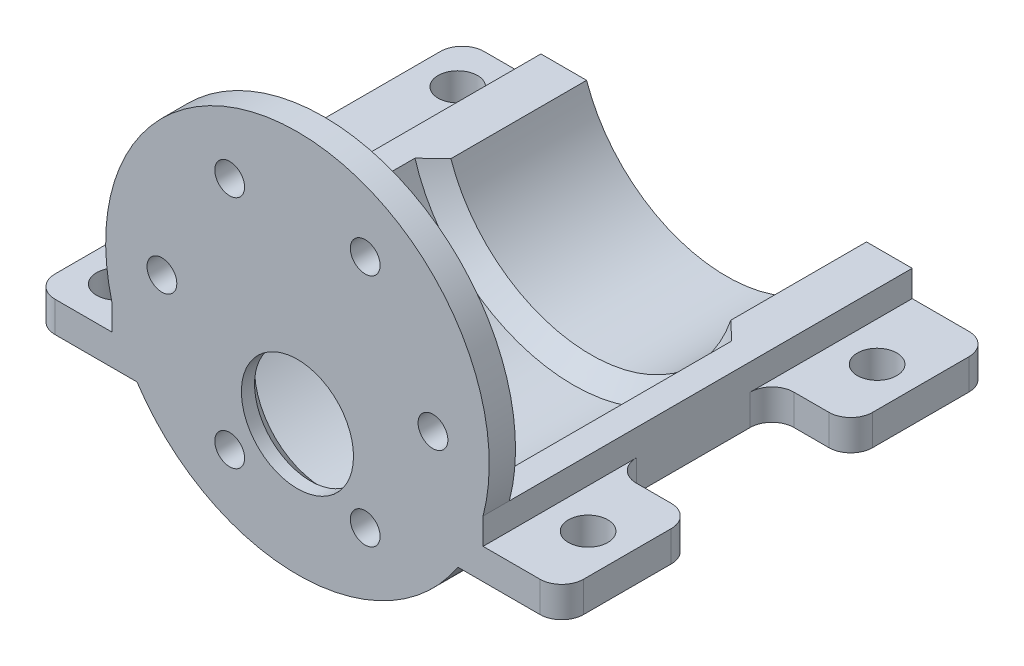
from build123d import *
from build123d.topology import SkipClean

# Parameters (mm, degrees)
BOSS_EXTRUDE1_START     = 94
SKETCH1_R               = 21.9
SKETCH1_R_2             = 1.7
SKETCH1_R_3             = 6.4
BOSS_EXTRUDE1_DEPTH     = 3
BOSS_EXTRUDE2_START     = 91
BOSS_EXTRUDE2_DEPTH     = 27.5
BOSS_EXTRUDE3_START     = 45
BOSS_EXTRUDE3_DEPTH     = 18.5
BOSS_EXTRUDE7_START     = 94
BOSS_EXTRUDE7_DEPTH     = 49
CUT_EXTRUDE5_DEPTH      = 104.301419283
CUT_EXTRUDE5_DEPTH_BACK = 104.301419283
SKETCH4_W               = 8.985048174
SKETCH4_H               = 18
SKETCH4_R               = 2.25
CHAMFER3_SIZE           = 3
CHAMFER4_SIZE           = 1.5
FILLET2_R               = 2.5


with BuildPart() as part:
    # Sketch1 → Boss-Extrude1 (new body)
    with BuildSketch(Plane.XY.offset(BOSS_EXTRUDE1_START)):
        Circle(SKETCH1_R)
        with Locations((15.475, 0)):
            Circle(SKETCH1_R_2, mode=Mode.SUBTRACT)
        with Locations((7.7375, -13.401743124)):
            Circle(SKETCH1_R_2, mode=Mode.SUBTRACT)
        with Locations((-7.7375, -13.401743124)):
            Circle(SKETCH1_R_2, mode=Mode.SUBTRACT)
        with Locations((-15.475, 0)):
            Circle(SKETCH1_R_2, mode=Mode.SUBTRACT)
        with Locations((-7.7375, 13.401743124)):
            Circle(SKETCH1_R_2, mode=Mode.SUBTRACT)
        with Locations((7.7375, 13.401743124)):
            Circle(SKETCH1_R_2, mode=Mode.SUBTRACT)
        with Locations((0, -7)):
            Circle(SKETCH1_R_3, mode=Mode.SUBTRACT)
    extrude(amount=-BOSS_EXTRUDE1_DEPTH)

    # Sketch1<5> → Boss-Extrude2 (add)
    with BuildSketch(Plane.XY.offset(BOSS_EXTRUDE2_START)):
        with BuildLine():
            ThreePointArc((18.319661569, -12), (19.330787418, -10.292262036), (20.183161298, -8.5))
            Line((20.183161298, -8.5), (16.880758277, -8.5))
            ThreePointArc((16.880758277, -8.5), (0, -18.9), (-16.880758277, -8.5))
            Line((-16.880758277, -8.5), (-20.183161298, -8.5))
            ThreePointArc((-20.183161298, -8.5), (-19.330787418, -10.292262036), (-18.319661569, -12))
            ThreePointArc((-18.319661569, -12), (0, -21.9), (18.319661569, -12))
        make_face()
        with BuildLine():
            Line((-20.183161298, -8.5), (-16.880758277, -8.5))
            ThreePointArc((-16.880758277, -8.5), (-17.545632887, -7.025721786), (-18.082035284, -5.5))
            Line((-18.082035284, -5.5), (-21.198113124, -5.5))
            ThreePointArc((-21.198113124, -5.5), (-20.744938375, -7.018371022), (-20.183161298, -8.5))
        make_face()
        with BuildLine():
            Line((16.880758277, -8.5), (20.183161298, -8.5))
            ThreePointArc((20.183161298, -8.5), (20.744938375, -7.018371022), (21.198113124, -5.5))
            Line((21.198113124, -5.5), (18.082035284, -5.5))
            ThreePointArc((18.082035284, -5.5), (17.545632887, -7.025721786), (16.880758277, -8.5))
        make_face()
    extrude(amount=-BOSS_EXTRUDE2_DEPTH)

    # Sketch1<6> → Boss-Extrude3 (add)
    with SkipClean():  # the faces are left unmerged after this step: merging them gives an invalid solid
        with BuildSketch(Plane.XY.offset(BOSS_EXTRUDE3_START)):
            with BuildLine():
                Line((21.198113124, -5.5), (15.979987484, -5.5))
                ThreePointArc((15.979987484, -5.5), (0, -16.9), (-15.979987484, -5.5))
                Line((-15.979987484, -5.5), (-21.198113124, -5.5))
                ThreePointArc((-21.198113124, -5.5), (0, -21.9), (21.198113124, -5.5))
            make_face()
        extrude(amount=BOSS_EXTRUDE3_DEPTH)

    # Sketch1<11> → Boss-Extrude7 (add)
    with SkipClean():  # the faces are left unmerged after this step: merging them gives an invalid solid
        with BuildSketch(Plane.XY.offset(BOSS_EXTRUDE7_START)):
            with BuildLine():
                ThreePointArc((21.198113124, -5.5), (20.024388359, -8.867574124), (18.319661569, -12))
                Line((18.319661569, -12), (30.183161298, -12))
                Line((30.183161298, -12), (30.183161298, -8.5))
                Line((30.183161298, -8.5), (21.198113124, -8.5))
                Line((21.198113124, -8.5), (21.198113124, -5.5))
            make_face()
            with BuildLine():
                Line((-30.183161298, -12), (-18.319661569, -12))
                ThreePointArc((-18.319661569, -12), (-20.024388359, -8.867574124), (-21.198113124, -5.5))
                Line((-21.198113124, -5.5), (-21.198113124, -8.5))
                Line((-21.198113124, -8.5), (-30.183161298, -8.5))
                Line((-30.183161298, -8.5), (-30.183161298, -12))
            make_face()
        extrude(amount=-BOSS_EXTRUDE7_DEPTH)

    # Sketch4 → Cut-Extrude5 (cut, two sides: drawn at the far end of the back side and taken through both)
    with SkipClean():  # the faces are left unmerged after this step: merging them gives an invalid solid
        with BuildSketch(Plane(origin=(0, -8.5, 0), x_dir=(1, 0, 0), z_dir=(0, 1, 0)).offset(-CUT_EXTRUDE5_DEPTH_BACK)):
            with Locations((25.690637211, -70)):
                Rectangle(SKETCH4_W, SKETCH4_H)
            with Locations(Location((-25.690637211, -50, 0), (0, 0, 270))):
                Circle(SKETCH4_R)
            with Locations(Location((-25.690637211, -89, 0), (0, 0, 270))):
                Circle(SKETCH4_R)
            with Locations(Location((25.690637211, -86.5, 0), (0, 0, 270))):
                Circle(SKETCH4_R)
            with Locations(Location((25.690637211, -53.5, 0), (0, 0, 270))):
                Circle(SKETCH4_R)
        extrude(amount=CUT_EXTRUDE5_DEPTH + CUT_EXTRUDE5_DEPTH_BACK, mode=Mode.SUBTRACT)

    # Chamfer3
    # the kernel refuses this chamfer: 3 mm, written as the material it takes off along each edge
    with BuildSketch(Plane(origin=(0, 0, 63.5), x_dir=(0.9921367643584464, 0.1251584627915844, 0), z_dir=(-0.1251584627915844, 0.9921367643584464, 0))) as chamfer3_piece_1_section:
        Polygon((16.9 + CHAMFER3_SIZE, 0), (16.9, CHAMFER3_SIZE), (16.9, 0), align=None)
    chamfer3_piece_1 = revolve(axis=Axis((0, 0, 63.5), (0, 0, -1)), revolution_arc=194.379813793, mode=Mode.PRIVATE)
    chamfer3_piece_1 = chamfer3_piece_1 & Plane(origin=(0, 0, 61.502732277), x_dir=(0.8931618135876879, -0.4497354497354555, 0), z_dir=(0, 0, 1)) * Cylinder(18.9, 80, mode=Mode.PRIVATE)
    add(chamfer3_piece_1, mode=Mode.SUBTRACT)

    # Chamfer4
    chamfer4_edges = [part.edges().sort_by_distance(p)[0] for p in [
        (-6.4, -7, 91),
    ]]
    chamfer(chamfer4_edges, length=CHAMFER4_SIZE)

    # Fillet2
    fillet2_edges = [part.edges().sort_by_distance(p)[0] for p in [
        (21.198113124, -10.25, 79),
        (21.198113124, -10.25, 61),
        (30.183161298, -10.25, 61),
        (30.183161298, -10.25, 79),
        (-30.183161298, -10.25, 45),
        (-30.183161298, -10.25, 94),
        (30.183161298, -10.25, 45),
        (30.183161298, -10.25, 94),
    ]]
    fillet(fillet2_edges, radius=FILLET2_R)


solid = part.part
